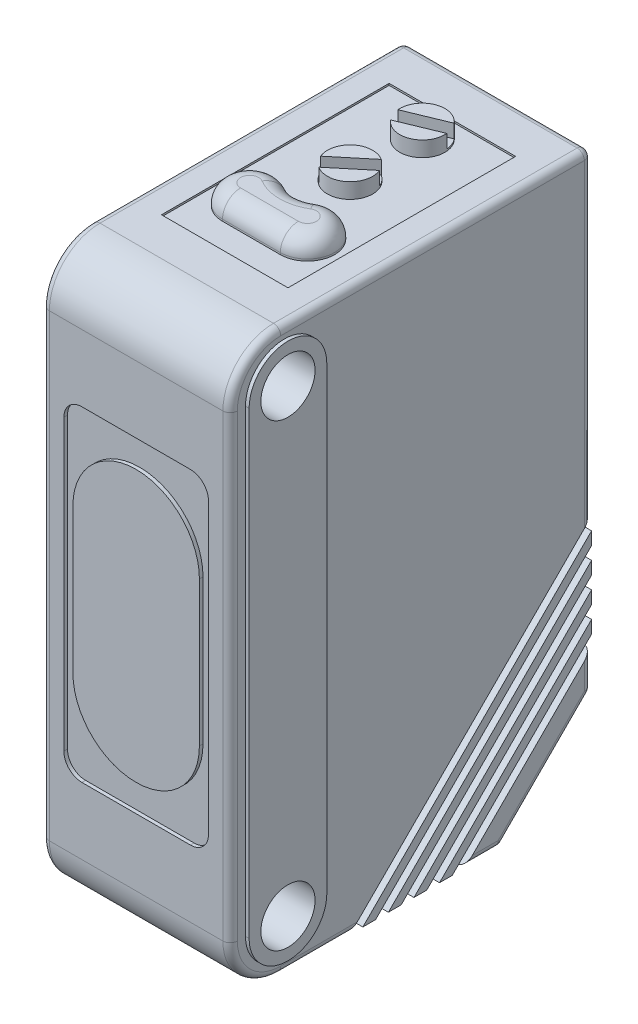
from build123d import *

# Parameters (mm, degrees)
ESQUISSE1_R             = 1.5
BOSS_EXTRU_1_DEPTH      = 10.4
ESQUISSE2_R             = 1.5
BOSS_EXTRU_3_DEPTH      = 0.2
BOSS_EXTRU_4_START      = 0.2
ESQUISSE3_R             = 1.5
BOSS_EXTRU_4_DEPTH      = 0.2
ENL_V_MAT_EXTRU_1_DEPTH = 0.2
ENL_V_MAT_EXTRU_3_DEPTH = 0.5
ENL_V_MAT_EXTRU_4_DEPTH = 0.5
CONG_1_R                = 0.4
ESQUISSE8_R             = 2
BOSS_EXTRU_5_DEPTH      = 3
CONG_2_R                = 0.4
ESQUISSE9_W             = 7
ESQUISSE9_H             = 12.59732845
ESQUISSE9_R             = 1.25
ENL_V_MAT_EXTRU_5_DEPTH = 0.1
BOSS_EXTRU_6_START      = 0.75
BOSS_EXTRU_6_DEPTH      = 0.75
BOSS_EXTRU_7_START      = 1
BOSS_EXTRU_7_DEPTH      = 1
CONG_3_R                = 1


with BuildPart() as part:
    # Esquisse1 → Boss.-Extru.1 (new body)
    with BuildSketch(Plane(origin=(0, 0, 0), x_dir=(0, 0, -1), z_dir=(1, 0, 0))):
        with BuildLine():
            Line((2.8, 0), (15, 0))
            Line((15, 0), (20, 5))
            Line((20, 5), (20, 31))
            Line((20, 31), (2.8, 31))
            ThreePointArc((2.8, 31), (0.820101013, 30.179898987), (0, 28.2))
            Line((0, 28.2), (0, 2.8))
            ThreePointArc((0, 2.8), (0.820101013, 0.820101013), (2.8, 0))
        make_face()
        with Locations((3, 28.2)):
            Circle(ESQUISSE1_R, mode=Mode.SUBTRACT)
        with Locations((3, 2.8)):
            Circle(ESQUISSE1_R, mode=Mode.SUBTRACT)
    extrude(amount=BOSS_EXTRU_1_DEPTH)

    # Esquisse2 → Boss.-Extru.3 (add)
    with BuildSketch(Plane(origin=(10.4, 0, 0), x_dir=(0, 0, -1), z_dir=(1, 0, 0))):
        with BuildLine():
            Line((5.15, 28.2), (5.15, 2.8))
            ThreePointArc((5.15, 2.8), (3, 0.65), (0.85, 2.8))
            Line((0.85, 2.8), (0.85, 28.2))
            ThreePointArc((0.85, 28.2), (3, 30.35), (5.15, 28.2))
        make_face()
        with Locations((3, 28.2)):
            Circle(ESQUISSE2_R, mode=Mode.SUBTRACT)
        with Locations((3, 2.8)):
            Circle(ESQUISSE2_R, mode=Mode.SUBTRACT)
    extrude(amount=BOSS_EXTRU_3_DEPTH)

    # Esquisse3 → Boss.-Extru.4 (add)
    with BuildSketch(Plane.ZY.offset(BOSS_EXTRU_4_START)):
        with BuildLine():
            Line((-0.85, 28.2), (-0.85, 2.8))
            ThreePointArc((-0.85, 2.8), (-3, 0.65), (-5.15, 2.8))
            Line((-5.15, 2.8), (-5.15, 28.2))
            ThreePointArc((-5.15, 28.2), (-3, 30.35), (-0.85, 28.2))
        make_face()
        with Locations((-3, 2.8)):
            Circle(ESQUISSE3_R, mode=Mode.SUBTRACT)
        with Locations((-3, 28.2)):
            Circle(ESQUISSE3_R, mode=Mode.SUBTRACT)
    extrude(amount=-BOSS_EXTRU_4_DEPTH)

    # Esquisse4 → Enlèv. mat.-Extru.1 (cut)
    with BuildSketch(Plane.XY):
        with BuildLine():
            Line((2.2, 24.5), (8.2, 24.5))
            ThreePointArc((8.2, 24.5), (8.907106781, 24.207106781), (9.2, 23.5))
            Line((9.2, 23.5), (9.2, 7.5))
            ThreePointArc((9.2, 7.5), (8.907106781, 6.792893219), (8.2, 6.5))
            Line((8.2, 6.5), (2.2, 6.5))
            ThreePointArc((2.2, 6.5), (1.492893219, 6.792893219), (1.2, 7.5))
            Line((1.2, 7.5), (1.2, 23.5))
            ThreePointArc((1.2, 23.5), (1.492893219, 24.207106781), (2.2, 24.5))
        make_face()
        with BuildLine():
            Line((8.7, 19.5), (8.7, 11.5))
            ThreePointArc((8.7, 11.5), (5.2, 8), (1.7, 11.5))
            Line((1.7, 11.5), (1.7, 19.5))
            ThreePointArc((1.7, 19.5), (5.2, 23), (8.7, 19.5))
        make_face(mode=Mode.SUBTRACT)
    extrude(amount=-ENL_V_MAT_EXTRU_1_DEPTH, mode=Mode.SUBTRACT)

    # Esquisse5 → Enlèv. mat.-Extru.3 (cut)
    with BuildSketch(Plane(origin=(10.4, 0, 0), x_dir=(0, 0, -1), z_dir=(1, 0, 0))):
        Polygon((13, 0), (20, 7), (20, 7.707106781), (12.292893219, 0), align=None)
        Polygon((11.585786438, 0), (20, 8.414213562), (20, 9.121320344), (10.878679656, 0), align=None)
        Polygon((20, 9.828427125), (10.171572875, 0), (9.464466094, 0), (20, 10.535533906), align=None)
        Polygon((20, 11.242640687), (8.757359313, 0), (8.050252532, 0), (20, 11.949747468), align=None)
        Polygon((7.343145751, 0), (20, 12.656854249), (20, 13.363961031), (6.636038969, 0), align=None)
    extrude(amount=-ENL_V_MAT_EXTRU_3_DEPTH, mode=Mode.SUBTRACT)

    # Esquisse7 → Enlèv. mat.-Extru.4 (cut)
    with BuildSketch(Plane.ZY):
        Polygon((-20, 7), (-13, 0), (-12.292893219, 0), (-20, 7.707106781), align=None)
        Polygon((-20, 8.414213562), (-11.585786438, 0), (-10.878679656, 0), (-20, 9.121320344), align=None)
        Polygon((-20, 9.828427125), (-20, 10.535533906), (-9.464466094, 0), (-10.171572875, 0), align=None)
        Polygon((-20, 11.242640687), (-8.757359313, 0), (-8.050252532, 0), (-20, 11.949747468), align=None)
        Polygon((-20, 12.656854249), (-20, 13.363961031), (-6.636038969, 0), (-7.343145751, 0), align=None)
    extrude(amount=-ENL_V_MAT_EXTRU_4_DEPTH, mode=Mode.SUBTRACT)

    # Congé1
    cong_1_edges = [part.edges().sort_by_distance(p)[0] for p in [
        (10.4, 30.179898987, -0.820101013),
        (5.2, 5, -20),
        (5.2, 0, -15),
        (5.2, 31, -20),
        (10.4, 15.5, 0),
        (10.4, 22.181980515, -20),
        (10.4, 0.820101013, -0.820101013),
        (0, 0, -14),
        (10.4, 0, -4.718019485),
        (10.4, 2.5, -17.5),
        (0, 22.181980515, -20),
        (10.4, 6, -20),
        (0, 2.5, -17.5),
        (10.4, 31, -11.4),
        (0, 0, -4.718019485),
        (0, 0.820101013, -0.820101013),
        (0, 15.5, 0),
        (0, 30.179898987, -0.820101013),
        (0, 31, -11.4),
        (0, 6, -20),
        (10.4, 0, -14),
    ]]
    fillet(cong_1_edges, radius=CONG_1_R)

    # Esquisse8 → Boss.-Extru.5 (add)
    with BuildSketch(Plane(origin=(0, -7.5, -7.5), x_dir=(1, 0, 0), z_dir=(0, -0.7071067811865512, -0.7071067811865438))):
        with Locations(Location((5.2, -14.142135624, 0), (0, 0, 90))):
            Circle(ESQUISSE8_R)
    extrude(amount=BOSS_EXTRU_5_DEPTH)

    # Congé2
    cong_2_edges = [part.edges().sort_by_distance(p)[0] for p in [
        (5.2, 3.914213562, -18.914213562),
    ]]
    fillet(cong_2_edges, radius=CONG_2_R)

    # Esquisse9 → Enlèv. mat.-Extru.5 (cut)
    with BuildSketch(Plane(origin=(0, 31, 0), x_dir=(1, 0, 0), z_dir=(0, 1, 0))):
        with Locations((5.2, 11.2)):
            Rectangle(ESQUISSE9_W, ESQUISSE9_H)
        with Locations(Location((5.2, 15.836199023, 0), (0, 0, 270))):
            Circle(ESQUISSE9_R, mode=Mode.SUBTRACT)
        with Locations(Location((5.2, 11.836199023, 0), (0, 0, 270))):
            Circle(ESQUISSE9_R, mode=Mode.SUBTRACT)
        with BuildLine():
            Line((3.6, 6.378161231), (6.8, 6.378161231))
            ThreePointArc((6.8, 6.378161231), (8.245782033, 8.277803961), (6.029604961, 9.165208815))
            ThreePointArc((6.029604961, 9.165208815), (5.2, 8.935889606), (4.370395039, 9.165208815))
            ThreePointArc((4.370395039, 9.165208815), (2.154217967, 8.277803961), (3.6, 6.378161231))
        make_face(mode=Mode.SUBTRACT)
    extrude(amount=-ENL_V_MAT_EXTRU_5_DEPTH, mode=Mode.SUBTRACT)

    # Esquisse10 → Boss.-Extru.6 (add)
    with BuildSketch(Plane(origin=(0, 31, 0), x_dir=(1, 0, 0), z_dir=(0, 1, 0)).offset(BOSS_EXTRU_6_START)):
        with BuildLine():
            Line((3.954711438, 15.727772098), (6.159077004, 16.637866847))
            ThreePointArc((6.159077004, 16.637866847), (4.722980738, 16.991600522), (3.954711438, 15.727772098))
        make_face()
        with BuildLine():
            Line((4.240922996, 15.034531199), (6.445288562, 15.944625947))
            ThreePointArc((6.445288562, 15.944625947), (5.677019262, 14.680797524), (4.240922996, 15.034531199))
        make_face()
        with BuildLine():
            Line((4.042878005, 11.363368516), (5.878209102, 12.886214458))
            ThreePointArc((5.878209102, 12.886214458), (4.401811845, 12.798173903), (4.042878005, 11.363368516))
        make_face()
        with BuildLine():
            Line((4.521790898, 10.786183588), (6.357121995, 12.30902953))
            ThreePointArc((6.357121995, 12.30902953), (5.998188155, 10.874224143), (4.521790898, 10.786183588))
        make_face()
    extrude(amount=-BOSS_EXTRU_6_DEPTH)

    # Esquisse12 → Boss.-Extru.7 (add)
    with BuildSketch(Plane(origin=(0, 31, 0), x_dir=(1, 0, 0), z_dir=(0, 1, 0)).offset(BOSS_EXTRU_7_START)):
        with BuildLine():
            Line((3.6, 6.378161231), (6.8, 6.378161231))
            ThreePointArc((6.8, 6.378161231), (8.245782033, 8.277803961), (6.029604961, 9.165208815))
            ThreePointArc((6.029604961, 9.165208815), (5.2, 8.935889606), (4.370395039, 9.165208815))
            ThreePointArc((4.370395039, 9.165208815), (2.154217967, 8.277803961), (3.6, 6.378161231))
        make_face()
    extrude(amount=-BOSS_EXTRU_7_DEPTH)

    # Congé3
    cong_3_edges = [part.edges().sort_by_distance(p)[0] for p in [
        (5.2, 32, -8.935889606),
        (2.154217967, 32, -8.277803961),
        (5.2, 32, -6.378161231),
        (8.245782033, 32, -8.277803961),
    ]]
    fillet(cong_3_edges, radius=CONG_3_R - 0.0001)  # a hair under: the kernel refuses the full size


solid = part.part
